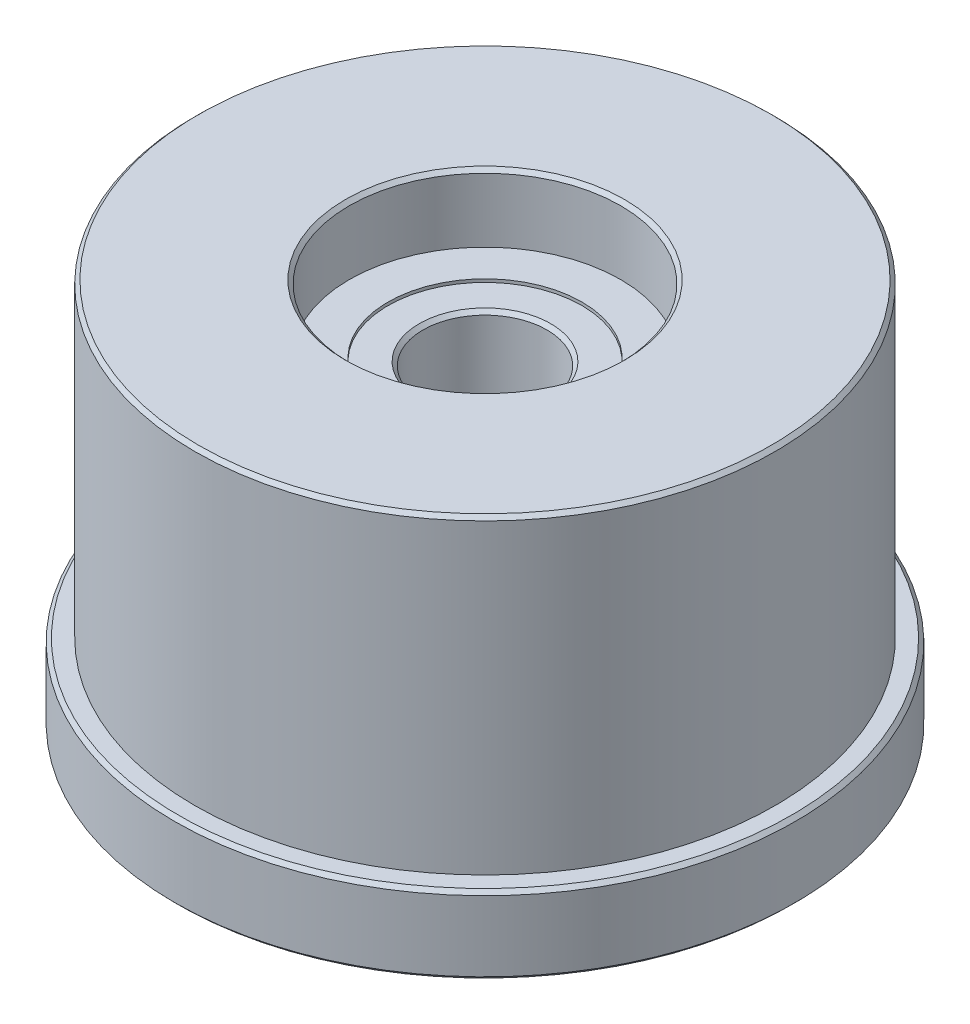
from build123d import *

# Parameters (mm, degrees)
SKETCH1_R           = 23.749
BOSS_EXTRUDE1_DEPTH = 25.4
SKETCH2_R           = 25.4
BOSS_EXTRUDE2_DEPTH = 6.35
SKETCH3_R           = 5.08
CUT_EXTRUDE1_DEPTH  = 48.941448664
SKETCH4_R           = 11.1125
CUT_EXTRUDE2_DEPTH  = 5.5372
SKETCH5_R           = 7.9375
CUT_EXTRUDE3_DEPTH  = 0.254
CHAMFER1_SIZE       = 0.299999908


with BuildPart() as part:
    # Sketch1 → Boss-Extrude1 (new body)
    with BuildSketch(Plane(origin=(0, 0, 0), x_dir=(1, 0, 0), z_dir=(0, 1, 0))):
        Circle(SKETCH1_R)
    extrude(amount=BOSS_EXTRUDE1_DEPTH)

    # Sketch2 → Boss-Extrude2 (add)
    with BuildSketch(Plane.XZ):
        Circle(SKETCH2_R)
    extrude(amount=BOSS_EXTRUDE2_DEPTH)

    # Sketch3 → Cut-Extrude1 (cut, through all)
    with BuildSketch(Plane.XZ.offset(6.35)):
        Circle(SKETCH3_R)
    extrude(amount=-CUT_EXTRUDE1_DEPTH, mode=Mode.SUBTRACT)

    # Sketch4 → Cut-Extrude2 (cut)
    with BuildSketch(Plane.XZ.offset(6.35)):
        Circle(SKETCH4_R)
    cut_extrude2 = extrude(amount=-CUT_EXTRUDE2_DEPTH, mode=Mode.SUBTRACT)

    # Sketch5 → Cut-Extrude3 (cut)
    with BuildSketch(Plane.XZ.offset(0.8128)):
        Circle(SKETCH5_R)
    cut_extrude3 = extrude(amount=-CUT_EXTRUDE3_DEPTH, mode=Mode.SUBTRACT)

    # Mirror1: Cut-Extrude2, Cut-Extrude3 across plane
    add(cut_extrude2.mirror(Plane.ZX.offset(9.525)), mode=Mode.SUBTRACT)
    add(cut_extrude3.mirror(Plane.ZX.offset(9.525)), mode=Mode.SUBTRACT)

    # Chamfer1
    chamfer1_edges = [part.edges().sort_by_distance(p)[0] for p in [
        (-25.4, 0, 0),
        (-25.4, -6.35, 0),
        (-11.1125, -6.35, 0),
        (-23.749, 25.4, 0),
        (-5.08, 19.6088, 0),
        (-5.08, -0.5588, 0),
        (-11.1125, 25.4, 0),
    ]]
    chamfer(chamfer1_edges, length=CHAMFER1_SIZE)


solid = part.part
